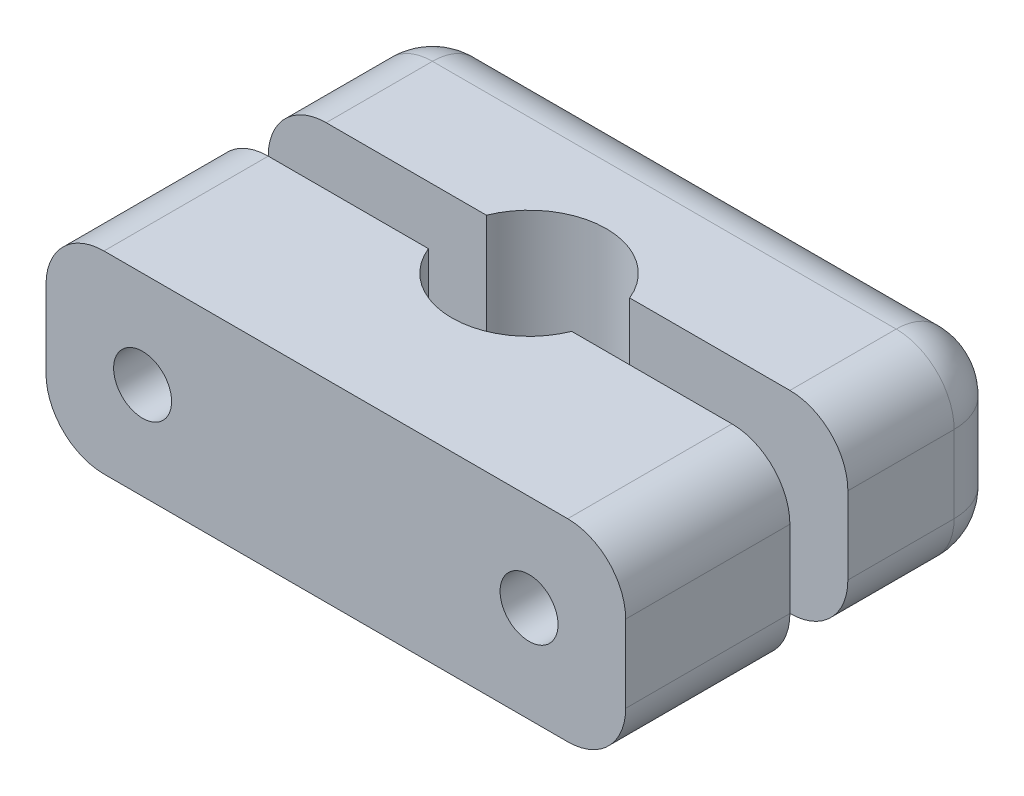
from build123d import *

# Parameters (mm, degrees)
SKETCH1_W           = 30
SKETCH1_H           = 20
BOSS_EXTRUDE1_DEPTH = 10
SKETCH2_R           = 4
CUT_EXTRUDE1_DEPTH  = 10
SKETCH3_R           = 1.5
CUT_EXTRUDE2_DEPTH  = 27.925824036
SKETCH4_R           = 2.5
CUT_EXTRUDE3_DEPTH  = 6
SKETCH5_W           = 30
SKETCH5_H           = 3
CUT_EXTRUDE4_DEPTH  = 21.615528128
FILLET2_R           = 3
FILLET3_R           = 3


with BuildPart() as part:
    # Sketch1 → Boss-Extrude1 (new body)
    with BuildSketch(Plane(origin=(0, 0, 0), x_dir=(1, 0, 0), z_dir=(0, 1, 0))):
        Rectangle(SKETCH1_W, SKETCH1_H)
    extrude(amount=BOSS_EXTRUDE1_DEPTH)

    # Sketch2 → Cut-Extrude1 (cut)
    with BuildSketch(Plane(origin=(0, 10, 0), x_dir=(1, 0, 0), z_dir=(0, 1, 0))):
        with Locations(Location((0, 0, 0), (0, 0, 270))):
            Circle(SKETCH2_R)
    extrude(amount=-CUT_EXTRUDE1_DEPTH, mode=Mode.SUBTRACT)

    # Sketch3 → Cut-Extrude2 (cut, through all)
    with BuildSketch(Plane.XY.offset(10)):
        with Locations((-10, 5)):
            Circle(SKETCH3_R)
        with Locations((10, 5)):
            Circle(SKETCH3_R)
    extrude(amount=-CUT_EXTRUDE2_DEPTH, mode=Mode.SUBTRACT)

    # Sketch4 → Cut-Extrude3 (cut)
    with BuildSketch(Plane(origin=(0, 0, -10), x_dir=(-1, 0, 0), z_dir=(0, 0, -1))):
        with Locations((-10, 5)):
            Circle(SKETCH4_R)
        with Locations((10, 5)):
            Circle(SKETCH4_R)
    extrude(amount=-CUT_EXTRUDE3_DEPTH, mode=Mode.SUBTRACT)

    # Sketch5 → Cut-Extrude4 (cut, through all)
    with BuildSketch(Plane(origin=(0, 10, 0), x_dir=(1, 0, 0), z_dir=(0, 1, 0))):
        Rectangle(SKETCH5_W, SKETCH5_H)
    extrude(amount=-CUT_EXTRUDE4_DEPTH, mode=Mode.SUBTRACT)


with BuildPart() as cut_extrude4_piece_1:
    # of the separate pieces the step leaves, piece 1, a body of its own (cut_extrude4_pieces)
    add(part.part.solids().sort_by_distance((-15, 0, 10))[0])

    # Fillet3
    fillet3_edges = [cut_extrude4_piece_1.edges().sort_by_distance(p)[0] for p in [
        (15, 10, 5.75),
        (-15, 0, 5.75),
        (-15, 10, 5.75),
        (15, 0, 5.75),
    ]]
    fillet(fillet3_edges, radius=FILLET3_R)


with BuildPart() as cut_extrude4_piece_2:
    # of the separate pieces the step leaves, piece 2, a body of its own (cut_extrude4_pieces)
    add(part.part.solids().sort_by_distance((-15, 0, -10))[0])

    # Fillet2
    # the kernel refuses this fillet: 3 mm, written as the material it takes off along each edge
    with BuildSketch(Plane(origin=(12, 3, -7), x_dir=(1, 0, 0), z_dir=(0, 0, -1))) as fillet2_piece_1_section:
        Polygon((0, 0), (FILLET2_R, 0), (FILLET2_R, FILLET2_R), (0, FILLET2_R), align=None)
    fillet2_piece_1 = extrude(amount=FILLET2_R, mode=Mode.PRIVATE)
    fillet2_piece_1 = fillet2_piece_1 - Plane(origin=(12, 3, -7), x_dir=(-0.7071067811865475, 0.7071067811865475, 0), z_dir=(0, 0, -1)) * Sphere(FILLET2_R, mode=Mode.PRIVATE)
    add(fillet2_piece_1, mode=Mode.SUBTRACT)
    with BuildSketch(Plane(origin=(-12, 3, -7), x_dir=(0, 0, -1), z_dir=(-1, 0, 0))) as fillet2_piece_2_section:
        Polygon((0, 0), (FILLET2_R, 0), (FILLET2_R, FILLET2_R), (0, FILLET2_R), align=None)
    fillet2_piece_2 = extrude(amount=FILLET2_R, mode=Mode.PRIVATE)
    fillet2_piece_2 = fillet2_piece_2 - Plane(origin=(-12, 3, -7), x_dir=(0, 0.7071067811865475, 0.7071067811865475), z_dir=(-1, 0, 0)) * Sphere(FILLET2_R, mode=Mode.PRIVATE)
    add(fillet2_piece_2, mode=Mode.SUBTRACT)
    with BuildSketch(Plane(origin=(-12, 7, -7), x_dir=(0, 0, -1), z_dir=(-1, 0, 0))) as fillet2_piece_3_section:
        Polygon((0, 0), (FILLET2_R, 0), (FILLET2_R, -FILLET2_R), (0, -FILLET2_R), align=None)
    fillet2_piece_3 = extrude(amount=FILLET2_R, mode=Mode.PRIVATE)
    fillet2_piece_3 = fillet2_piece_3 - Plane(origin=(-12, 7, -7), x_dir=(0, -0.7071067811865475, 0.7071067811865475), z_dir=(-1, 0, 0)) * Sphere(FILLET2_R, mode=Mode.PRIVATE)
    add(fillet2_piece_3, mode=Mode.SUBTRACT)
    with BuildSketch(Plane(origin=(12, 7, -7), x_dir=(1, 0, 0), z_dir=(0, 0, -1))) as fillet2_piece_4_section:
        Polygon((0, 0), (FILLET2_R, 0), (FILLET2_R, -FILLET2_R), (0, -FILLET2_R), align=None)
    fillet2_piece_4 = extrude(amount=FILLET2_R, mode=Mode.PRIVATE)
    fillet2_piece_4 = fillet2_piece_4 - Plane(origin=(12, 7, -7), x_dir=(-0.7071067811865475, -0.7071067811865475, 0), z_dir=(0, 0, -1)) * Sphere(FILLET2_R, mode=Mode.PRIVATE)
    add(fillet2_piece_4, mode=Mode.SUBTRACT)
    with BuildSketch(Plane(origin=(15, 0, 6), x_dir=(0, 1, 0), z_dir=(0, 0, -1)), Plane(origin=(-15, 0, -7), x_dir=(0, 1, 0), z_dir=(0, 0, 1))) as fillet2_piece_5:
        with BuildLine():
            CenterArc((FILLET2_R, -FILLET2_R), FILLET2_R, 90, 90)
            Line((0, -FILLET2_R), (0, 0))
            Line((0, 0), (FILLET2_R, 0))
        make_face()
    extrude(amount=13, mode=Mode.SUBTRACT)
    with BuildSketch(Plane(origin=(-15, 3, -10), x_dir=(0, 0, 1), z_dir=(0, 1, 0)), Plane(origin=(15, 3, -10), x_dir=(-1, 0, 0), z_dir=(0, 1, 0))) as fillet2_piece_6:
        with BuildLine():
            CenterArc((FILLET2_R, FILLET2_R), FILLET2_R, 180, 90)
            Line((0, FILLET2_R), (0, 0))
            Line((0, 0), (FILLET2_R, 0))
        make_face()
    extrude(amount=4, mode=Mode.SUBTRACT)
    with BuildSketch(Plane(origin=(-15, 10, -7), x_dir=(0, -1, 0), z_dir=(0, 0, 1)), Plane(origin=(15, 10, 6), x_dir=(0, -1, 0), z_dir=(0, 0, -1))) as fillet2_piece_7:
        with BuildLine():
            CenterArc((FILLET2_R, FILLET2_R), FILLET2_R, 180, 90)
            Line((0, FILLET2_R), (0, 0))
            Line((0, 0), (FILLET2_R, 0))
        make_face()
    extrude(amount=13, mode=Mode.SUBTRACT)
    with BuildSketch(Plane(origin=(12, 10, -10), x_dir=(0, -1, 0), z_dir=(-1, 0, 0))) as fillet2_piece_8:
        with BuildLine():
            CenterArc((FILLET2_R, FILLET2_R), FILLET2_R, 180, 90)
            Line((0, FILLET2_R), (0, 0))
            Line((0, 0), (FILLET2_R, 0))
        make_face()
    extrude(amount=24, mode=Mode.SUBTRACT)
    with BuildSketch(Plane(origin=(12, 0, -10), x_dir=(0, 1, 0), z_dir=(-1, 0, 0))) as fillet2_piece_9:
        with BuildLine():
            CenterArc((FILLET2_R, -FILLET2_R), FILLET2_R, 90, 90)
            Line((0, -FILLET2_R), (0, 0))
            Line((0, 0), (FILLET2_R, 0))
        make_face()
    extrude(amount=24, mode=Mode.SUBTRACT)


solid = Compound([cut_extrude4_piece_1.part, cut_extrude4_piece_2.part])
